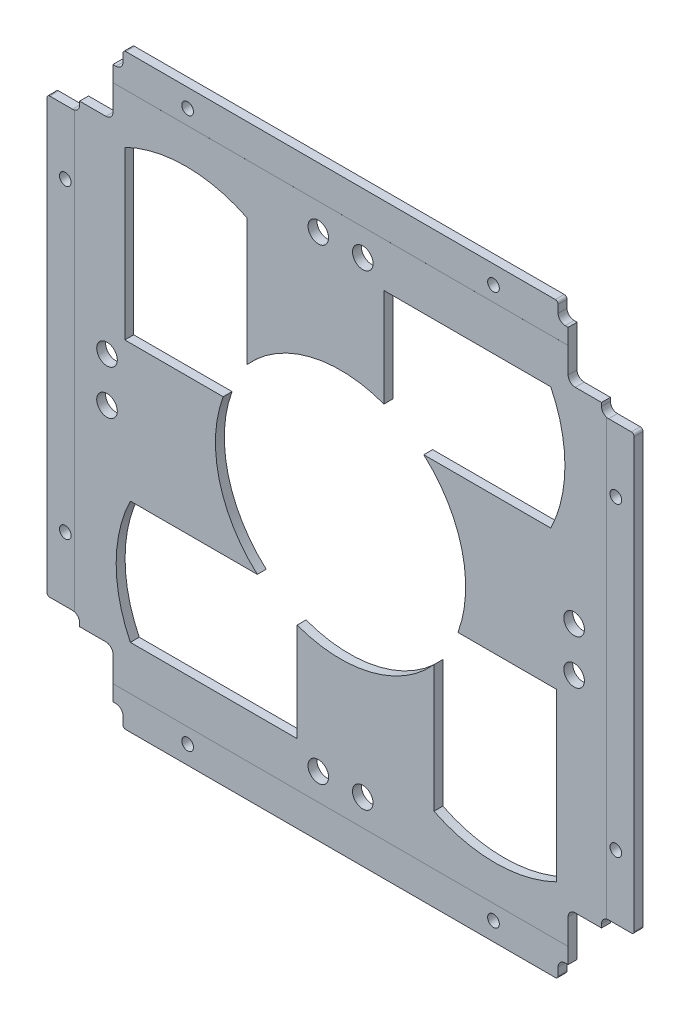
from build123d import *

# Parameters (mm, degrees)
SKETCH1_W                 = 106
SKETCH1_H                 = 106
MAINOUTLINE_DEPTH         = 1.6
SKETCH4_W                 = 11.7
SKETCH4_H                 = 11.7
RAILCUTOUTS_DEPTH         = 75.970394157
SKETCH13_W                = 5.7
SKETCH13_H                = 1.9
SKETCH13_W_2              = 1.8
SKETCH13_H_2              = 3
FILLETCUTOUTS_DEPTH       = 75.970394157
SMOOTHCORNER_DEPTH        = 10
MIRROR2_COPY_1_SKETCH_W   = 11.7
MIRROR2_COPY_1_SKETCH_H   = 11.7
MIRROR2_COPY_1_DEPTH      = 75.970394157
MIRROR2_COPY_2_SKETCH_W   = 5.7
MIRROR2_COPY_2_SKETCH_H   = 1.9
MIRROR2_COPY_2_SKETCH_W_2 = 1.8
MIRROR2_COPY_2_SKETCH_H_2 = 3
MIRROR2_COPY_2_DEPTH      = 75.970394157
MIRROR2_COPY_3_DEPTH      = 10
MIRROR2_COPY_4_SKETCH_W   = 11.7
MIRROR2_COPY_4_SKETCH_H   = 11.7
MIRROR2_COPY_4_DEPTH      = 75.970394157
MIRROR2_COPY_5_SKETCH_W   = 5.7
MIRROR2_COPY_5_SKETCH_H   = 1.9
MIRROR2_COPY_5_SKETCH_W_2 = 1.8
MIRROR2_COPY_5_SKETCH_H_2 = 3
MIRROR2_COPY_5_DEPTH      = 75.970394157
MIRROR2_COPY_6_DEPTH      = 10
M2_CLEARANCE_HOLE1_D      = 2.1
SKETCH16_W                = 90
SKETCH16_H                = 6.2
SKETCH16_W_2              = 5.2
SKETCH16_H_2              = 90
CUT_EXTRUDE6_DEPTH        = 0.001
CUT_EXTRUDE10_DEPTH       = 75.970394157
CUT_EXTRUDE10_DEPTH_BACK  = 75.970394157
SKETCH21_R                = 22.5
SKETCH24_OUTSIDE_W        = 137.984
SKETCH24_OUTSIDE_H        = 137.984
SKETCH24_OUTSIDE_W_2      = 105.6
SKETCH24_OUTSIDE_H_2      = 105.6
CUT_EXTRUDE19_DEPTH       = 75.970394157
FILLET7_R                 = 0.5
F_1_0MM_DOWEL_HOLE1_D     = 3.7
CUT_EXTRUDE23_DEPTH       = 75.687616109


with BuildPart() as part:
    # Sketch1 → mainOutline (new body)
    with BuildSketch(Plane.XY):
        Rectangle(SKETCH1_W, SKETCH1_H)
    extrude(amount=MAINOUTLINE_DEPTH)

    # Sketch4 → railCutouts (cut, through all)
    with BuildSketch(Plane(origin=(0, 0, 0), x_dir=(-1, 0, 0), z_dir=(0, 0, -1))):
        with Locations((47.15, 47.15)):
            Rectangle(SKETCH4_W, SKETCH4_H)
    railcutouts = extrude(amount=-RAILCUTOUTS_DEPTH, mode=Mode.SUBTRACT)

    # Sketch13 → filletCutouts (cut, symmetric)
    with BuildSketch(Plane(origin=(0, 0, 0), x_dir=(-1, 0, 0), z_dir=(0, 0, -1))):
        with Locations((50.15, 40.35)):
            Rectangle(SKETCH13_W, SKETCH13_H)
        with Locations((40.4, 51.5)):
            Rectangle(SKETCH13_W_2, SKETCH13_H_2)
    filletcutouts = extrude(amount=FILLETCUTOUTS_DEPTH, both=True, mode=Mode.SUBTRACT)

    # Sketch27 → smoothCorner (cut)
    with BuildSketch(Plane.XY.offset(1.6)):
        with BuildLine():
            Line((-40.928025612, 42.198025612), (-40.928025612, 49.628025612))
            Line((-40.928025612, 49.628025612), (-40.398025612, 49.628025612))
            ThreePointArc((-40.398025612, 49.628025612), (-39.5, 50), (-39.128025612, 50.898025612))
            Line((-39.128025612, 50.898025612), (-39.128025612, 53))
            Line((-39.128025612, 53), (-53, 53))
            Line((-53, 53), (-53, 39.028025612))
            Line((-53, 39.028025612), (-48.198025612, 39.028025612))
            ThreePointArc((-48.198025612, 39.028025612), (-47.3, 39.4), (-46.928025612, 40.298025612))
            Line((-46.928025612, 40.298025612), (-46.928025612, 40.928025612))
            Line((-46.928025612, 40.928025612), (-42.198025612, 40.928025612))
            ThreePointArc((-42.198025612, 40.928025612), (-41.3, 41.3), (-40.928025612, 42.198025612))
        make_face()
    smoothcorner = extrude(amount=-SMOOTHCORNER_DEPTH, mode=Mode.SUBTRACT)

    # Mirror1: railCutouts, filletCutouts, smoothCorner across plane
    add(railcutouts.mirror(Plane(origin=(0, 0, 0), x_dir=(0, 0, 1), z_dir=(1, 0, 0))), mode=Mode.SUBTRACT)
    add(filletcutouts.mirror(Plane(origin=(0, 0, 0), x_dir=(0, 0, 1), z_dir=(1, 0, 0))), mode=Mode.SUBTRACT)
    add(smoothcorner.mirror(Plane(origin=(0, 0, 0), x_dir=(0, 0, 1), z_dir=(1, 0, 0))), mode=Mode.SUBTRACT)

    # Mirror2 copy 1 sketch → Mirror2 copy 1 (cut, through all)
    with BuildSketch(Plane(origin=(0, 0, 0), x_dir=(1, 0, 0), z_dir=(0, 0, -1))):
        with Locations((47.15, 47.15)):
            Rectangle(MIRROR2_COPY_1_SKETCH_W, MIRROR2_COPY_1_SKETCH_H)
    extrude(amount=-MIRROR2_COPY_1_DEPTH, mode=Mode.SUBTRACT)

    # Mirror2 copy 2 sketch → Mirror2 copy 2 (cut, symmetric)
    with BuildSketch(Plane(origin=(0, 0, 0), x_dir=(1, 0, 0), z_dir=(0, 0, -1))):
        with Locations((50.15, 40.35)):
            Rectangle(MIRROR2_COPY_2_SKETCH_W, MIRROR2_COPY_2_SKETCH_H)
        with Locations((40.4, 51.5)):
            Rectangle(MIRROR2_COPY_2_SKETCH_W_2, MIRROR2_COPY_2_SKETCH_H_2)
    extrude(amount=MIRROR2_COPY_2_DEPTH, both=True, mode=Mode.SUBTRACT)

    # Mirror2 copy 3 sketch → Mirror2 copy 3 (cut)
    with BuildSketch(Plane(origin=(0, 0, 1.6), x_dir=(-1, 0, 0), z_dir=(0, 0, 1))):
        with BuildLine():
            Line((-40.928025612, 42.198025612), (-40.928025612, 49.628025612))
            Line((-40.928025612, 49.628025612), (-40.398025612, 49.628025612))
            ThreePointArc((-40.398025612, 49.628025612), (-39.5, 50), (-39.128025612, 50.898025612))
            Line((-39.128025612, 50.898025612), (-39.128025612, 53))
            Line((-39.128025612, 53), (-53, 53))
            Line((-53, 53), (-53, 39.028025612))
            Line((-53, 39.028025612), (-48.198025612, 39.028025612))
            ThreePointArc((-48.198025612, 39.028025612), (-47.3, 39.4), (-46.928025612, 40.298025612))
            Line((-46.928025612, 40.298025612), (-46.928025612, 40.928025612))
            Line((-46.928025612, 40.928025612), (-42.198025612, 40.928025612))
            ThreePointArc((-42.198025612, 40.928025612), (-41.3, 41.3), (-40.928025612, 42.198025612))
        make_face()
    extrude(amount=-MIRROR2_COPY_3_DEPTH, mode=Mode.SUBTRACT)

    # Mirror2 copy 4 sketch → Mirror2 copy 4 (cut, through all)
    with BuildSketch(Plane(origin=(0, 0, 0), x_dir=(-1, 0, 0), z_dir=(0, 0, -1))):
        with Locations((47.15, -47.15)):
            Rectangle(MIRROR2_COPY_4_SKETCH_W, MIRROR2_COPY_4_SKETCH_H)
    extrude(amount=-MIRROR2_COPY_4_DEPTH, mode=Mode.SUBTRACT)

    # Mirror2 copy 5 sketch → Mirror2 copy 5 (cut, symmetric)
    with BuildSketch(Plane(origin=(0, 0, 0), x_dir=(-1, 0, 0), z_dir=(0, 0, -1))):
        with Locations((50.15, -40.35)):
            Rectangle(MIRROR2_COPY_5_SKETCH_W, MIRROR2_COPY_5_SKETCH_H)
        with Locations((40.4, -51.5)):
            Rectangle(MIRROR2_COPY_5_SKETCH_W_2, MIRROR2_COPY_5_SKETCH_H_2)
    extrude(amount=MIRROR2_COPY_5_DEPTH, both=True, mode=Mode.SUBTRACT)

    # Mirror2 copy 6 sketch → Mirror2 copy 6 (cut)
    with BuildSketch(Plane.XY.offset(1.6)):
        with BuildLine():
            Line((-40.928025612, -42.198025612), (-40.928025612, -49.628025612))
            Line((-40.928025612, -49.628025612), (-40.398025612, -49.628025612))
            ThreePointArc((-40.398025612, -49.628025612), (-39.5, -50), (-39.128025612, -50.898025612))
            Line((-39.128025612, -50.898025612), (-39.128025612, -53))
            Line((-39.128025612, -53), (-53, -53))
            Line((-53, -53), (-53, -39.028025612))
            Line((-53, -39.028025612), (-48.198025612, -39.028025612))
            ThreePointArc((-48.198025612, -39.028025612), (-47.3, -39.4), (-46.928025612, -40.298025612))
            Line((-46.928025612, -40.298025612), (-46.928025612, -40.928025612))
            Line((-46.928025612, -40.928025612), (-42.198025612, -40.928025612))
            ThreePointArc((-42.198025612, -40.928025612), (-41.3, -41.3), (-40.928025612, -42.198025612))
        make_face()
    extrude(amount=-MIRROR2_COPY_6_DEPTH, mode=Mode.SUBTRACT)

    # M2 Clearance Hole1 (through all)
    with Locations(Plane(origin=(0, 0, 0), x_dir=(-1, 0, 0), z_dir=(0, 0, -1))):
        with Locations((49.5, -27.5), (27.5, -49.5), (-49.5, -27.5), (-27.5, -49.5), (-27.5, 49.5), (-49.5, 27.5), (27.5, 49.5), (49.5, 27.5)):
            Hole(M2_CLEARANCE_HOLE1_D / 2)

    # Sketch16 → Cut-Extrude6 (cut)
    with BuildSketch(Plane.XY.offset(1.6)):
        with Locations((0, -49.9)):
            Rectangle(SKETCH16_W, SKETCH16_H)
        with Locations((0, 49.9)):
            Rectangle(SKETCH16_W, SKETCH16_H)
        with Locations((-50.4, 0)):
            Rectangle(SKETCH16_W_2, SKETCH16_H_2)
        with Locations((50.4, 0)):
            Rectangle(SKETCH16_W_2, SKETCH16_H_2)
    extrude(amount=-CUT_EXTRUDE6_DEPTH, mode=Mode.SUBTRACT)

    # Sketch21 → Cut-Extrude10 (cut, two sides: drawn at the far end of the back side and taken through both)
    with BuildSketch(Plane.XY.offset(-CUT_EXTRUDE10_DEPTH_BACK)):
        Circle(SKETCH21_R)
    extrude(amount=CUT_EXTRUDE10_DEPTH + CUT_EXTRUDE10_DEPTH_BACK, mode=Mode.SUBTRACT)

    # Sketch24 outside → Cut-Extrude19 (cut, through all)
    with BuildSketch(Plane.XY.offset(1.6)):
        Rectangle(SKETCH24_OUTSIDE_W, SKETCH24_OUTSIDE_H)
        Rectangle(SKETCH24_OUTSIDE_W_2, SKETCH24_OUTSIDE_H_2, mode=Mode.SUBTRACT)
    extrude(amount=-CUT_EXTRUDE19_DEPTH, mode=Mode.SUBTRACT)

    # Fillet7
    fillet7_edges = [part.edges().sort_by_distance(p)[0] for p in [
        (-52.8, -39.028025612, 0.7995),
        (-39.128025612, -52.8, 0.7995),
        (39.128025612, -52.8, 0.7995),
        (52.8, -39.028025612, 0.7995),
        (52.8, 39.028025612, 0.7995),
        (39.128025612, 52.8, 0.7995),
        (-39.128025612, 52.8, 0.7995),
        (-52.8, 39.028025612, 0.7995),
    ]]
    fillet(fillet7_edges, radius=FILLET7_R)

    # Ø1.0mm Dowel Hole1 (through all)
    with Locations(Plane(origin=(42, -4, 0), x_dir=(-1, 0, 0), z_dir=(0, 0, -1))):
        with Locations((0, 0), (0, 8), (46, 46), (38, 46), (84, 8), (84, 0), (38, -38), (46, -38)):
            Hole(F_1_0MM_DOWEL_HOLE1_D / 2)

    # Sketch33 → Cut-Extrude23 (cut, through all)
    with BuildSketch(Plane(origin=(0, 0, 0), x_dir=(-1, 0, 0), z_dir=(0, 0, -1))):
        with BuildLine():
            Line((-7.8, 16.8), (-7.8, 38.8))
            Line((-7.8, 38.8), (-37.8, 38.8))
            ThreePointArc((-37.8, 38.8), (-40.350055679, 27.8), (-37.8, 16.8))
            Line((-37.8, 16.8), (-7.8, 16.8))
        make_face()
        with BuildLine():
            Line((-16.8, -7.8), (-38.8, -7.8))
            Line((-38.8, -7.8), (-38.8, -37.8))
            ThreePointArc((-38.8, -37.8), (-27.8, -40.350055679), (-16.8, -37.8))
            Line((-16.8, -37.8), (-16.8, -7.8))
        make_face()
        with BuildLine():
            Line((16.8, 7.8), (38.8, 7.8))
            Line((38.8, 7.8), (38.8, 37.8))
            ThreePointArc((38.8, 37.8), (27.8, 40.350055679), (16.8, 37.8))
            Line((16.8, 37.8), (16.8, 7.8))
        make_face()
        with BuildLine():
            Line((7.8, -16.8), (7.8, -38.8))
            Line((7.8, -38.8), (37.8, -38.8))
            ThreePointArc((37.8, -38.8), (40.350055679, -27.8), (37.8, -16.8))
            Line((37.8, -16.8), (7.8, -16.8))
        make_face()
    extrude(amount=-CUT_EXTRUDE23_DEPTH, mode=Mode.SUBTRACT)


solid = part.part
